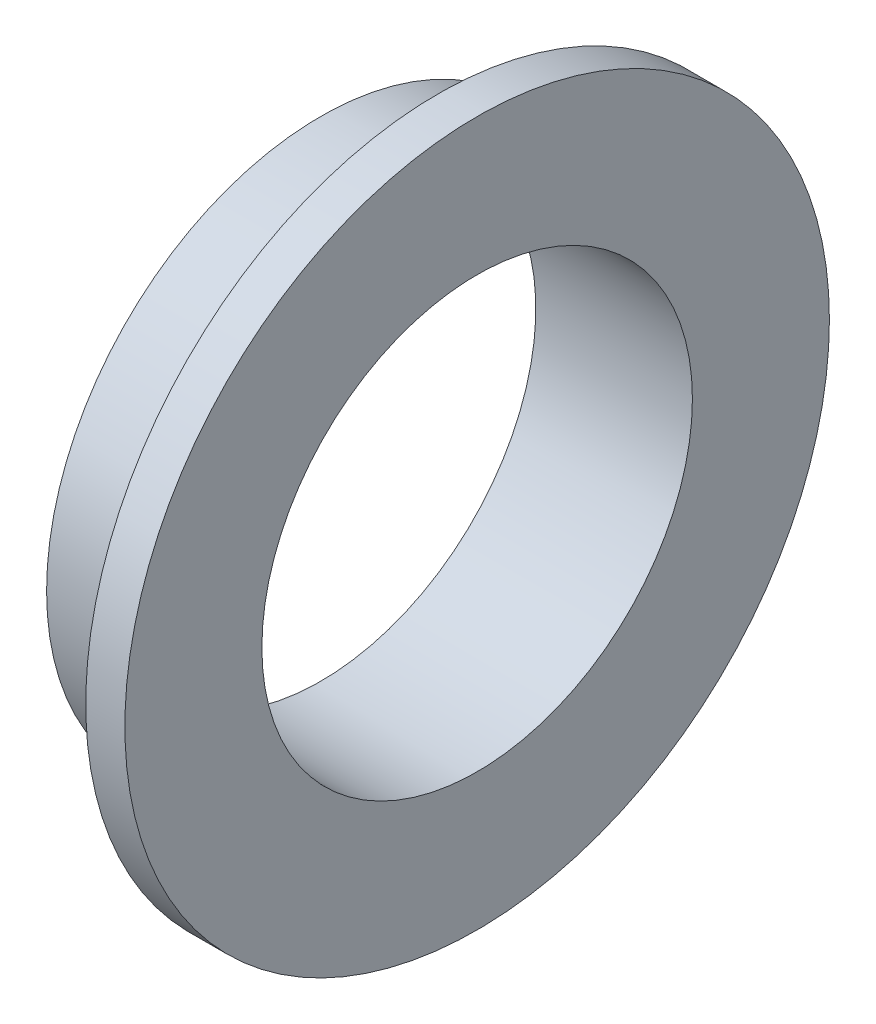
from build123d import *
from build123d.topology import SkipClean

# Parameters (mm, degrees)
SKETCH1_R           = 57.15
SKETCH1_R_2         = 34.925
BOSS_EXTRUDE1_DEPTH = 6.35
BOSS_EXTRUDE2_START = 19.05
SKETCH2_R           = 44.45
SKETCH2_R_2         = 34.925
BOSS_EXTRUDE2_DEPTH = 19.05


with BuildPart() as part:
    # Sketch1 → Boss-Extrude1 (new body)
    with BuildSketch(Plane(origin=(0, 0, 0), x_dir=(0, 0, -1), z_dir=(1, 0, 0))):
        Circle(SKETCH1_R)
        Circle(SKETCH1_R_2, mode=Mode.SUBTRACT)
    extrude(amount=BOSS_EXTRUDE1_DEPTH)

    # Sketch2 → Boss-Extrude2 (add)
    with SkipClean():  # the faces are left unmerged after this step: merging them gives an invalid solid
        with BuildSketch(Plane.ZY.offset(BOSS_EXTRUDE2_START)):
            Circle(SKETCH2_R)
            Circle(SKETCH2_R_2, mode=Mode.SUBTRACT)
        extrude(amount=-BOSS_EXTRUDE2_DEPTH)


solid = part.part
